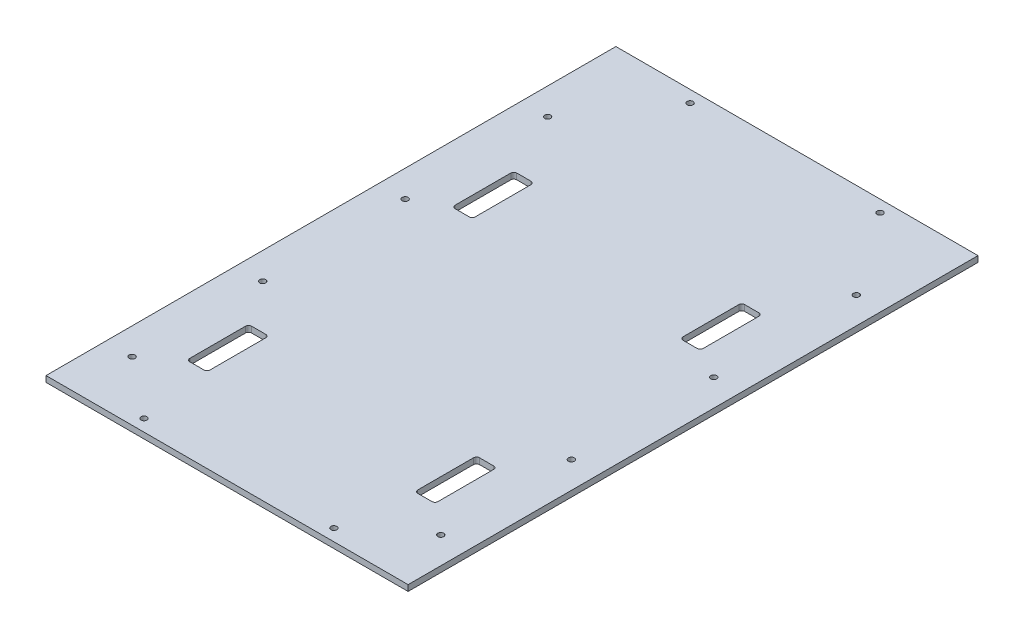
from build123d import *

# Parameters (mm, degrees)
SKETCH1_W           = 387.35
SKETCH1_H           = 609.6
BOSS_EXTRUDE1_DEPTH = 6.35
SKETCH2_W           = 21.59
SKETCH2_H           = 66.04
CUT_EXTRUDE1_DEPTH  = 362.183288823
FILLET1_R           = 3.175
SKETCH3_R           = 3.175
CUT_EXTRUDE2_DEPTH  = 362.183288823


with BuildPart() as part:
    # Sketch1 → Boss-Extrude1 (new body)
    with BuildSketch(Plane(origin=(0, 0, 0), x_dir=(1, 0, 0), z_dir=(0, 1, 0))):
        Rectangle(SKETCH1_W, SKETCH1_H)
    extrude(amount=BOSS_EXTRUDE1_DEPTH)

    # Sketch2 → Cut-Extrude1 (cut, through all)
    with BuildSketch(Plane(origin=(0, 6.35, 0), x_dir=(1, 0, 0), z_dir=(0, 1, 0))):
        with Locations((121.92, -182.118)):
            Rectangle(SKETCH2_W, SKETCH2_H)
        with Locations((121.92, 101.6)):
            Rectangle(SKETCH2_W, SKETCH2_H)
        with Locations((-121.92, -182.118)):
            Rectangle(SKETCH2_W, SKETCH2_H)
        with Locations((-121.92, 101.6)):
            Rectangle(SKETCH2_W, SKETCH2_H)
    extrude(amount=-CUT_EXTRUDE1_DEPTH, mode=Mode.SUBTRACT)

    # Fillet1
    fillet1_edges = [part.edges().sort_by_distance(p)[0] for p in [
        (-132.715, 3.175, -134.62),
        (-111.125, 3.175, -134.62),
        (132.715, 3.175, 215.138),
        (132.715, 3.175, 149.098),
        (111.125, 3.175, 149.098),
        (111.125, 3.175, 215.138),
        (-111.125, 3.175, 215.138),
        (-132.715, 3.175, 215.138),
        (-111.125, 3.175, 149.098),
        (-132.715, 3.175, 149.098),
        (132.715, 3.175, -68.58),
        (111.125, 3.175, -68.58),
        (132.715, 3.175, -134.62),
        (111.125, 3.175, -134.62),
        (-111.125, 3.175, -68.58),
        (-132.715, 3.175, -68.58),
    ]]
    fillet(fillet1_edges, radius=FILLET1_R)

    # Sketch3 → Cut-Extrude2 (cut, through all)
    with BuildSketch(Plane(origin=(0, 0, 0), x_dir=(-1, 0, 0), z_dir=(0, -1, 0))):
        with Locations((101.6, 292.1)):
            Circle(SKETCH3_R)
        with Locations((165.1, 203.2)):
            Circle(SKETCH3_R)
        with Locations((165.1, -101.6)):
            Circle(SKETCH3_R)
        with Locations((165.1, 50.8)):
            Circle(SKETCH3_R)
        with Locations((165.1, -241.3)):
            Circle(SKETCH3_R)
        with Locations((-165.1, -241.3)):
            Circle(SKETCH3_R)
        with Locations((-165.1, -101.6)):
            Circle(SKETCH3_R)
        with Locations((-165.1, 50.8)):
            Circle(SKETCH3_R)
        with Locations((-165.1, 203.2)):
            Circle(SKETCH3_R)
        with Locations((-101.6, 292.1)):
            Circle(SKETCH3_R)
        with Locations((101.6, -292.1)):
            Circle(SKETCH3_R)
        with Locations((-101.6, -292.1)):
            Circle(SKETCH3_R)
    extrude(amount=-CUT_EXTRUDE2_DEPTH, mode=Mode.SUBTRACT)


solid = part.part
